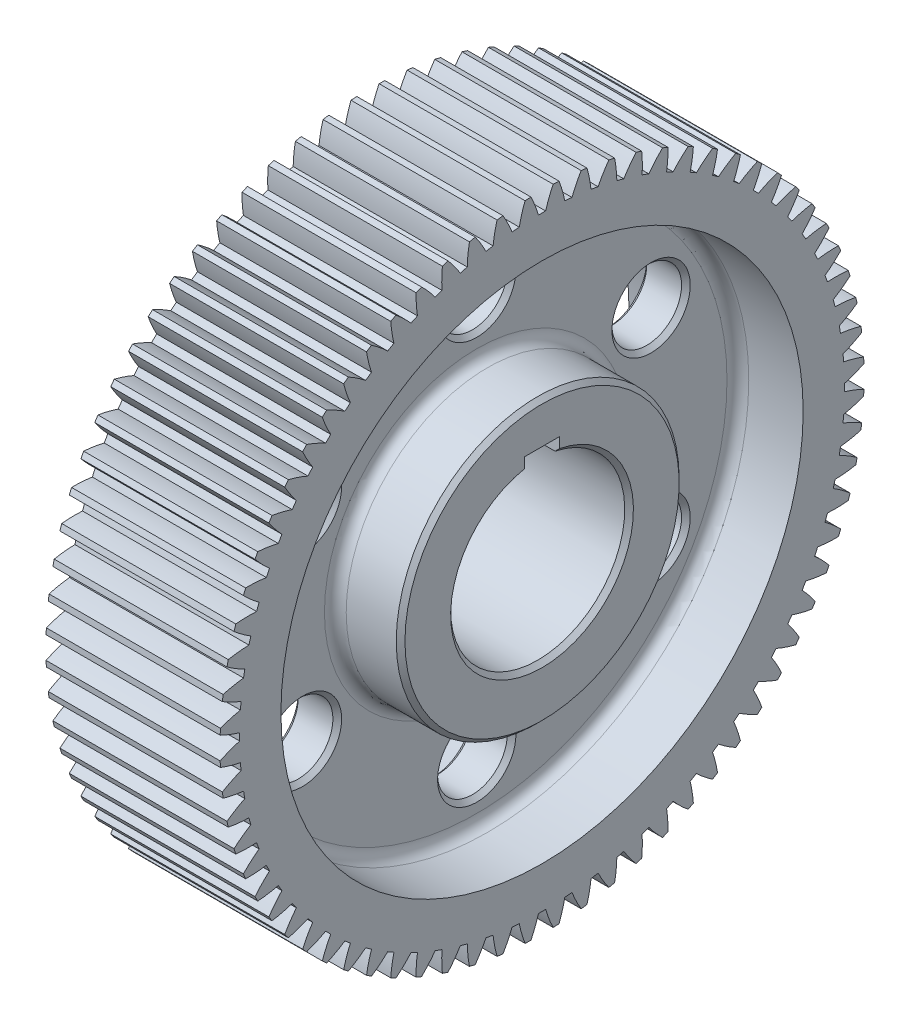
from build123d import *

# Parameters (mm, degrees)
BASPROSKE_W        = 80
BASPROSKE_H        = 148
TOOTHCUT_DEPTH     = 225.071417187
TEETHCUTS_COUNT    = 72
TEETHCUTS_ANGLE    = 355
BORSKE_R           = 40
BORE_DEPTH         = 80.0000508
SKETCH1_R          = 120
SKETCH1_R_2        = 65
CUT_EXTRUDE1_DEPTH = 30
CUT_EXTRUDE2_START = -30
SKETCH2_R          = 120
SKETCH2_R_2        = 65
CUT_EXTRUDE2_DEPTH = 30
SKETCH3_R          = 16
CUT_EXTRUDE3_DEPTH = 216.071959351
SKETCH4_W          = 16
SKETCH4_H          = 12
CUT_EXTRUDE4_DEPTH = 224.955235927
FILLET1_R          = 5
CHAMFER1_SIZE      = 2


with BuildPart() as part:
    # BasProSke → Base-Revolve (revolve)
    with BuildSketch(Plane(origin=(0, 0, 0), x_dir=(1, 0, 0), z_dir=(0, 1, 0))):
        with Locations((40, 74)):
            Rectangle(BASPROSKE_W, BASPROSKE_H)
    revolve(axis=Axis((-10, 0, 0), (1, 0, 0)))

    # TooCutSke → ToothCut (cut, through all)
    with BuildSketch(Plane(origin=(0, 0, 0), x_dir=(0, 0, -1), z_dir=(1, 0, 0))):
        with BuildLine():
            ThreePointArc((1.653765718, 138.989161664), (0, 138.999), (-1.653765718, 138.989161664))
            ThreePointArc((-1.653765718, 138.989161664), (-3.197131327, 143.53526187), (-5.113722447, 147.937043663))
            ThreePointArc((-5.113722447, 147.937043663), (0, 148.0254), (5.113722447, 147.937043663))
            ThreePointArc((5.113722447, 147.937043663), (3.197131327, 143.53526187), (1.653765718, 138.989161664))
        make_face()
    toothcut = extrude(amount=TOOTHCUT_DEPTH, mode=Mode.SUBTRACT)

    # TeethCuts: ToothCut ×72 about axis
    teethcuts_axis = Axis((-10, 0, 0), (1, 0, 0))
    for i in range(1, TEETHCUTS_COUNT):
        add(toothcut.rotate(teethcuts_axis, i * TEETHCUTS_ANGLE / (TEETHCUTS_COUNT - 1)), mode=Mode.SUBTRACT)

    # BorSke → Bore (cut, symmetric)
    with BuildSketch(Plane(origin=(0, 0, 0), x_dir=(0, 0, -1), z_dir=(1, 0, 0))):
        Circle(BORSKE_R)
    extrude(amount=BORE_DEPTH, both=True, mode=Mode.SUBTRACT)

    # Sketch1 → Cut-Extrude1 (cut)
    with BuildSketch(Plane(origin=(80, 0, 0), x_dir=(0, 0, -1), z_dir=(1, 0, 0))):
        Circle(SKETCH1_R)
        Circle(SKETCH1_R_2, mode=Mode.SUBTRACT)
    extrude(amount=-CUT_EXTRUDE1_DEPTH, mode=Mode.SUBTRACT)

    # Sketch2 → Cut-Extrude2 (cut)
    with BuildSketch(Plane.ZY.offset(CUT_EXTRUDE2_START)):
        Circle(SKETCH2_R)
        Circle(SKETCH2_R_2, mode=Mode.SUBTRACT)
    extrude(amount=CUT_EXTRUDE2_DEPTH, mode=Mode.SUBTRACT)

    # Sketch3 → Cut-Extrude3 (cut, through all)
    with BuildSketch(Plane(origin=(50, 0, 0), x_dir=(0, 0, -1), z_dir=(1, 0, 0))):
        with Locations((0, 92.5)):
            Circle(SKETCH3_R)
        with Locations((80.10734985, 46.25)):
            Circle(SKETCH3_R)
        with Locations((80.10734985, -46.25)):
            Circle(SKETCH3_R)
        with Locations((0, -92.5)):
            Circle(SKETCH3_R)
        with Locations((-80.10734985, -46.25)):
            Circle(SKETCH3_R)
        with Locations((-80.10734985, 46.25)):
            Circle(SKETCH3_R)
    extrude(amount=-CUT_EXTRUDE3_DEPTH, mode=Mode.SUBTRACT)

    # Sketch4 → Cut-Extrude4 (cut, through all)
    with BuildSketch(Plane(origin=(80, 0, 0), x_dir=(0, 0, -1), z_dir=(1, 0, 0))):
        with Locations((0, 40)):
            Rectangle(SKETCH4_W, SKETCH4_H)
    extrude(amount=-CUT_EXTRUDE4_DEPTH, mode=Mode.SUBTRACT)

    # Fillet1
    fillet1_edges = [part.edges().sort_by_distance(p)[0] for p in [
        (30, 0, -120),
        (30, 0, -65),
        (50, 0, 65),
        (50, 0, 120),
    ]]
    fillet(fillet1_edges, radius=FILLET1_R)

    # Chamfer1
    chamfer1_edges = [part.edges().sort_by_distance(p)[0] for p in [
        (50, 46.25, -64.10734985),
        (30, 46.25, -64.10734985),
        (50, 92.5, 16),
        (30, 92.5, 16),
        (50, 46.25, 96.10734985),
        (30, 46.25, 96.10734985),
        (50, -46.25, 96.10734985),
        (30, -46.25, 96.10734985),
        (50, -46.25, -64.10734985),
        (30, -46.25, -64.10734985),
        (50, -92.5, 16),
        (30, -92.5, 16),
        (80, 0, 65),
        (80, -40, 0),
        (0, 0, -65),
        (0, -40, 0),
    ]]
    chamfer(chamfer1_edges, length=CHAMFER1_SIZE)


solid = part.part
